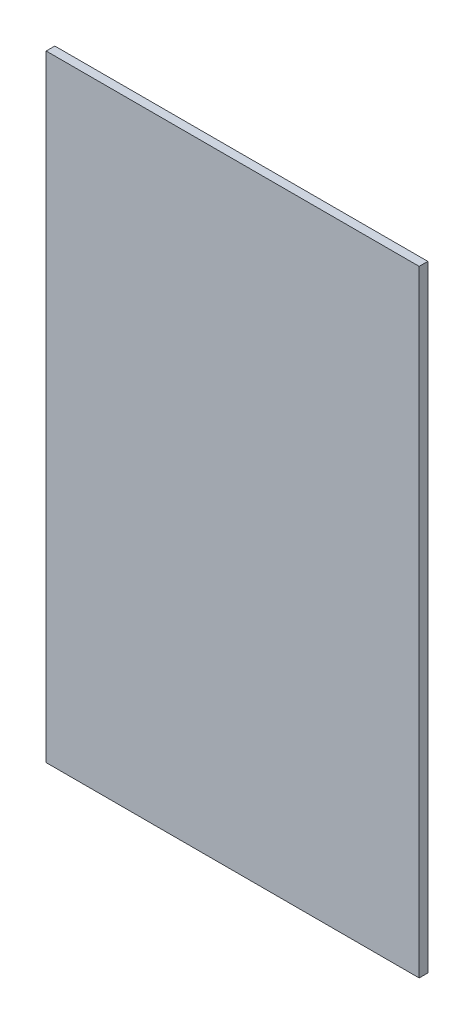
from build123d import *

# Parameters (mm, degrees)
SKETCH1_W           = 69
SKETCH1_H           = 114
BOSS_EXTRUDE1_DEPTH = 1.6


with BuildPart() as part:
    # Sketch1 → Boss-Extrude1 (new body)
    with BuildSketch(Plane.XY):
        with Locations((6.724018476, 3.027713626)):
            Rectangle(SKETCH1_W, SKETCH1_H)
    extrude(amount=BOSS_EXTRUDE1_DEPTH)


solid = part.part
